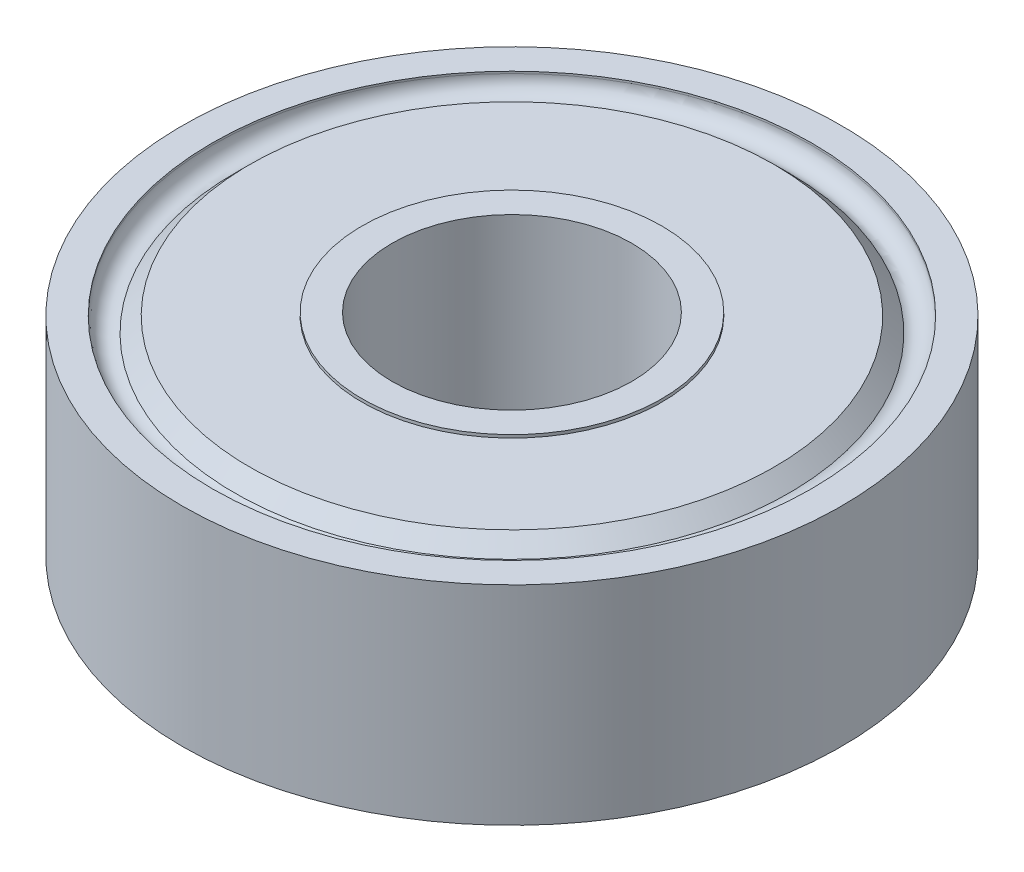
from build123d import *

# Parameters (mm, degrees)
SKETCH_1_R             = 11
EXTRUDE_1_DEPTH        = 3.475
SKETCH_3_R             = 10
SKETCH_3_R_2           = 9.75
CUT_EXTRUDE_2_DEPTH    = 0.5
FILLET_4_R             = 0.5
SKETCH_7_R             = 4
CUT_EXTRUDE_3_DEPTH    = 16.939749841
SKETCH_15_R            = 5
EXTRUDE_7_DEPTH        = 0.1
SKETCH_18_R            = 4
CUT_EXTRUDE_4_DEPTH    = 16.961849047
FILLET_4_OF_MIRROR_3_R = 0.5
SKETCH_19_R            = 4
CUT_EXTRUDE_5_DEPTH    = 18.120820658


with BuildPart() as part:
    # Эскиз1 → Бобышка-Вытянуть1 (new body)
    with BuildSketch(Plane(origin=(0, 0, 0), x_dir=(1, 0, 0), z_dir=(0, 1, 0))):
        with Locations(Location((0, 0, 0), (0, 0, 270))):
            Circle(SKETCH_1_R)
    extrude_1 = extrude(amount=EXTRUDE_1_DEPTH)

    # Эскиз3 → Вырез-Вытянуть2 (cut)
    with BuildSketch(Plane.XZ):
        with Locations(Location((0, 0, 0), (0, 0, 270))):
            Circle(SKETCH_3_R)
        with Locations(Location((0, 0, 0), (0, 0, 270))):
            Circle(SKETCH_3_R_2, mode=Mode.SUBTRACT)
    cut_extrude_2 = extrude(amount=-CUT_EXTRUDE_2_DEPTH, mode=Mode.SUBTRACT)

    # Скругление4
    # the kernel refuses this fillet: 0.5 mm, written as the material it adds along each edge
    with BuildSketch(Plane(origin=(0, 0.5, 0), x_dir=(0, 0, -1), z_dir=(-1, 0, 0))) as fillet_4_piece_1:
        with BuildLine():
            CenterArc((9.5, 0.433012702), FILLET_4_R, 300, 60)
            Line((9.75, 0), (9.755, -0.008660254))
            ThreePointArc((9.755, -0.008660254), (9.875, -0.01), (10, -0.01))
            Line((10, -0.01), (10.01, 0))
            Line((10.01, 0), (10.01, 0.433012702))
            Line((10.01, 0.433012702), (10, 0.433012702))
        make_face()
    revolve(axis=Axis((0, 0.5, 0), (0, -1, 0)))

    # Фаска1: read off the stored shape, not the designer's step
    # Фаска1 outline → Фаска1 (revolve, cut)
    with BuildSketch(Plane.XY):
        with BuildLine():
            Line((9.25, 0.5), (8.75, 0))
            Line((8.75, 0), (9.75, 0))
            Line((9.75, 0), (9.75, 0.5))
            ThreePointArc((9.75, 0.5), (9.5, 0.566987298), (9.25, 0.5))
        make_face()
    chamfer_1 = revolve(axis=Axis((0, 0, 0), (0, 1, 0)), mode=Mode.SUBTRACT)

    # Эскиз7 → Вырез-Вытянуть3 (cut, symmetric)
    with BuildSketch(Plane.XZ):
        with Locations(Location((0, 0, 0), (0, 0, 270))):
            Circle(SKETCH_7_R)
    cut_extrude_3 = extrude(amount=CUT_EXTRUDE_3_DEPTH, both=True, mode=Mode.SUBTRACT)

    # Эскиз15 → Бобышка-Вытянуть7 (add)
    with BuildSketch(Plane.XZ):
        with Locations(Location((0, 0, 0), (0, 0, 90))):
            Circle(SKETCH_15_R)
    extrude_7 = extrude(amount=EXTRUDE_7_DEPTH)

    # Эскиз18 → Вырез-Вытянуть4 (cut, through all)
    with BuildSketch(Plane.XZ.offset(0.1)):
        with Locations(Location((0, 0, 0), (0, 0, 270))):
            Circle(SKETCH_18_R)
    extrude(amount=-CUT_EXTRUDE_4_DEPTH, mode=Mode.SUBTRACT)

    # Зеркальное отражение3: Бобышка-Вытянуть1, Вырез-Вытянуть2, Фаска1, Вырез-Вытянуть3, Бобышка-Вытянуть7 across plane
    add(extrude_1.mirror(Plane.ZX.offset(3.475)))
    add(cut_extrude_2.mirror(Plane.ZX.offset(3.475)), mode=Mode.SUBTRACT)
    add(chamfer_1.mirror(Plane.ZX.offset(3.475)), mode=Mode.SUBTRACT)
    add(cut_extrude_3.mirror(Plane.ZX.offset(3.475)), mode=Mode.SUBTRACT)
    add(extrude_7.mirror(Plane.ZX.offset(3.475)))

    # Скругление4 of Зеркальное отражение3
    # the kernel refuses this fillet: 0.5 mm, written as the material it adds along each edge
    with BuildSketch(Plane(origin=(0, 6.45, 0), x_dir=(0, 0, -1), z_dir=(-1, 0, 0))) as fillet_4_of_mirror_3_piece_1:
        with BuildLine():
            CenterArc((9.5, -0.433012702), FILLET_4_OF_MIRROR_3_R, 0, 60)
            Line((9.75, 0), (9.755, 0.008660254))
            ThreePointArc((9.755, 0.008660254), (9.875, 0.01), (10, 0.01))
            Line((10, 0.01), (10.01, 0))
            Line((10.01, 0), (10.01, -0.433012702))
            Line((10.01, -0.433012702), (10, -0.433012702))
        make_face()
    revolve(axis=Axis((0, 6.45, 0), (0, -1, 0)))

    # Эскиз19 → Вырез-Вытянуть5 (cut, through all)
    with BuildSketch(Plane(origin=(0, 7.05, 0), x_dir=(1, 0, 0), z_dir=(0, 1, 0))):
        with Locations(Location((0, 0, 0), (0, 0, 90))):
            Circle(SKETCH_19_R)
    extrude(amount=-CUT_EXTRUDE_5_DEPTH, mode=Mode.SUBTRACT)


solid = part.part
